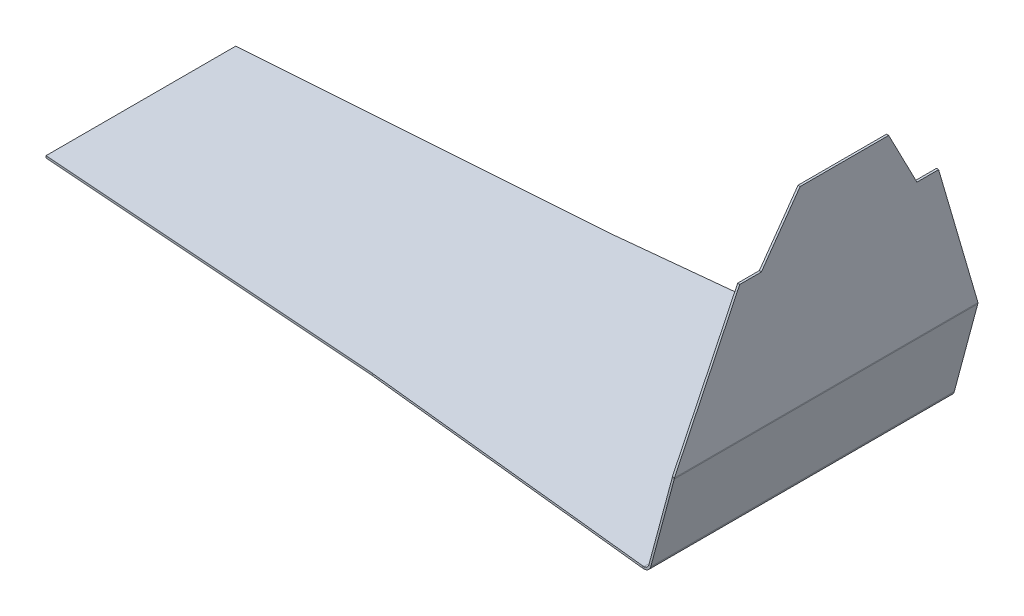
from build123d import *

# Parameters (mm, degrees)
BOSS_EXTRUDE1_DEPTH          = 10
CONVERT_SOLID1_DEPTH         = 6
EDGE_FLANGE2_DEPTH           = 600
EDGE_FLANGE4_STRIP_CUT_DEPTH = 600
EDGE_FLANGE4_DEPTH           = 600
CUT_EXTRUDE2_DEPTH           = 952.374861111
CUT_EXTRUDE2_DEPTH_BACK      = 952.374861111
TAB1_DEPTH                   = 4


# Read off the part's stored shape, not the designer's step: Convert-Solid1
# Sheet-metal steps are written as plain solids
with BuildPart() as part:
    # Sketch1 → Boss-Extrude1 (new body)
    with BuildSketch(Plane(origin=(0, 0, 0), x_dir=(1, 0, 0), z_dir=(0, 1, 0))):
        Polygon((-192.279765905, 237.5), (404.456147209, 300), (404.456147209, 0), (404.456147209, -300), (-192.279765905, -237.5), align=None)
    extrude(amount=BOSS_EXTRUDE1_DEPTH)

    # Convert-Solid1 outline → Convert-Solid1 (cut)
    with BuildSketch(Plane(origin=(0, 0, 0), x_dir=(1, 0, 0), z_dir=(0, 1, 0))):
        Polygon((-192.279765905, 237.5), (-192.279765905, -237.5), (404.456147209, -300), (404.456147209, 300), align=None)
    extrude(amount=CONVERT_SOLID1_DEPTH, mode=Mode.SUBTRACT)

    # Edge-Flange2 section (across the edge) → Edge-Flange2 (add)
    with BuildSketch(Plane(origin=(414.456147209, 10, 300), x_dir=(-0.9659258262890673, 0.25881904510252446, 0), z_dir=(0, 0, -1))):
        with BuildLine():
            Line((-4, 7.67326988), (-4, 187.930692048))
            Line((-4, 187.930692048), (0, 187.930692048))
            Line((0, 187.930692048), (0, 7.67326988))
            ThreePointArc((0, 7.67326988), (2.066466597, 1.58565559), (7.411809549, -1.985988383))
            Line((7.411809549, -1.985988383), (9.659258263, -2.588190451))
            Line((9.659258263, -2.588190451), (8.623982082, -6.451893756))
            Line((8.623982082, -6.451893756), (6.376533369, -5.849691688))
            ThreePointArc((6.376533369, -5.849691688), (-1.106946764, -0.849390126), (-4, 7.67326988))
        make_face()
    extrude(amount=EDGE_FLANGE2_DEPTH)

    # Edge-Flange4 strip (across the edge) → Edge-Flange4 strip cut (cut)
    with BuildSketch(Plane(origin=(463.09618947, 191.527109002, 300), x_dir=(-0.9961946980917449, 0.0871557427476667, 0), z_dir=(0, 0, -1))):
        Polygon((-10.038642938, 33.896891256), (-3.787308542, -1.556187852), (0.15192247, -0.861595141), (-6.099411926, 34.591483967), align=None)
    extrude(amount=EDGE_FLANGE4_STRIP_CUT_DEPTH, mode=Mode.SUBTRACT)

    # Edge-Flange4 section (across the edge) → Edge-Flange4 (add)
    with BuildSketch(Plane(origin=(463.09618947, 191.527109002, 300), x_dir=(-0.9961946980917449, 0.0871557427476667, 0), z_dir=(0, 0, -1))):
        with BuildLine():
            Line((-4, 0.874886635), (-4, 412.850045346))
            Line((-4, 412.850045346), (0, 412.850045346))
            Line((0, 412.850045346), (0, 0.874886635))
            ThreePointArc((0, 0.874886635), (0.038053019, 0.003329208), (0.15192247, -0.861595141))
            Line((0.15192247, -0.861595141), (-3.787308542, -1.556187852))
            ThreePointArc((-3.787308542, -1.556187852), (-3.946725773, -0.345293763), (-4, 0.874886635))
        make_face()
    extrude(amount=EDGE_FLANGE4_DEPTH)

    # Sketch22 → Cut-Extrude2 (cut, two sides: drawn at the far end of the back side and taken through both)
    with BuildSketch(Plane(origin=(442.9492869, -38.753041121, 0), x_dir=(0, 0, 1), z_dir=(-0.9961946980917449, 0.08715574274766662, 0)).offset(-CUT_EXTRUDE2_DEPTH_BACK)):
        Polygon((300, 232.03466952), (196.591479546, 525.272945681), (153.798650158, 525.272945681), (87.551647761, 644.009828231), (302.699803465, 645.121208779), (304.833664863, 232.03466952), align=None)
        Polygon((-300, 232.03466952), (-196.591479546, 525.272945681), (-153.798650158, 525.272945681), (-87.551647761, 644.009828231), (-302.699803465, 645.121208779), (-304.833664863, 232.03466952), align=None)
    extrude(amount=CUT_EXTRUDE2_DEPTH + CUT_EXTRUDE2_DEPTH_BACK, mode=Mode.SUBTRACT)

    # Sketch24 → Tab1 (add)
    with BuildSketch(Plane(origin=(0, 10, 0), x_dir=(1, 0, 0), z_dir=(0, 1, 0))):
        Polygon((-192.279765905, 237.5), (-887.537085834, 187.5), (-887.537085834, -187.5), (-192.279765905, -237.5), align=None)
    extrude(amount=-TAB1_DEPTH)


solid = part.part
